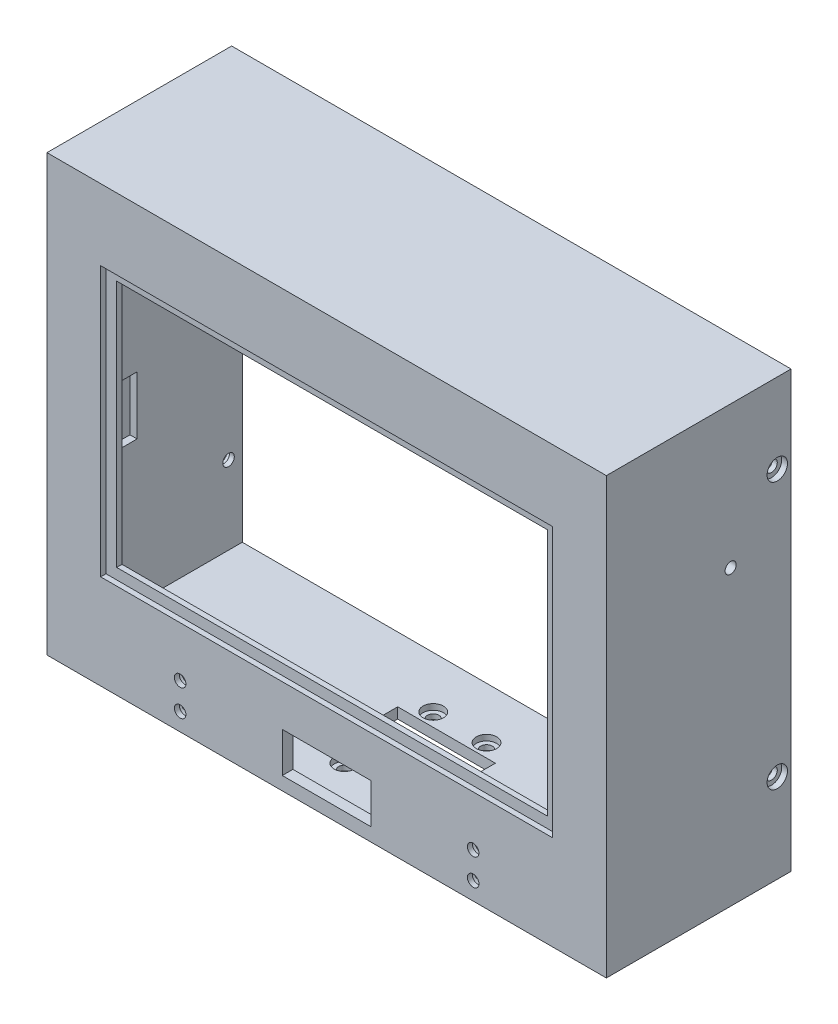
from build123d import *

# Parameters (mm, degrees)
BOSS_EXTRUDE1_START  = 38.4
SKETCH1_W            = 126
SKETCH1_H            = 98
BOSS_EXTRUDE1_DEPTH  = 41.6
BOSS_EXTRUDE2_START  = 36
SKETCH2_W            = 121.2
SKETCH2_H            = 93.2
BOSS_EXTRUDE2_DEPTH  = 41.6
BOSS_EXTRUDE3_START  = 76.6
SKETCH3_W            = 97
SKETCH3_H            = 55.86
BOSS_EXTRUDE3_DEPTH  = 4.4
BOSS_EXTRUDE4_START  = 78.8
SKETCH4_W            = 101.8
SKETCH4_H            = 60.7
BOSS_EXTRUDE4_DEPTH  = 2.2
BOSS_EXTRUDE5_START  = 73.1
SKETCH5_R            = 2.8
BOSS_EXTRUDE5_DEPTH  = 4.5
BOSS_EXTRUDE6_START  = 72.1
SKETCH6_R            = 1
BOSS_EXTRUDE6_DEPTH  = 7.1
BOSS_EXTRUDE7_START  = 73.1
SKETCH7_R            = 2.8
BOSS_EXTRUDE7_DEPTH  = 4.5
BOSS_EXTRUDE8_START  = 72.1
SKETCH8_R            = 1
BOSS_EXTRUDE8_DEPTH  = 7.1
BOSS_EXTRUDE9_START  = 73.1
SKETCH9_R            = 2.8
BOSS_EXTRUDE9_DEPTH  = 4.5
BOSS_EXTRUDE10_START = 72.1
SKETCH10_R           = 1
BOSS_EXTRUDE10_DEPTH = 7.1
BOSS_EXTRUDE11_START = 73.1
SKETCH11_R           = 2.8
BOSS_EXTRUDE11_DEPTH = 4.5
BOSS_EXTRUDE12_START = 72.1
SKETCH12_R           = 1
BOSS_EXTRUDE12_DEPTH = 7.1
BOSS_EXTRUDE13_START = 65.9
SKETCH13_W           = 3.9
SKETCH13_H           = 14
BOSS_EXTRUDE13_DEPTH = 8
BOSS_EXTRUDE14_START = 62.1
SKETCH14_W           = 2.1
SKETCH14_H           = 13.1
BOSS_EXTRUDE14_DEPTH = 12
BOSS_EXTRUDE15_START = -60.6
SKETCH15_R           = 8.3
BOSS_EXTRUDE15_DEPTH = 1.2
BOSS_EXTRUDE16_START = -60.6
SKETCH16_R           = 7.3
BOSS_EXTRUDE16_DEPTH = 1.3
BOSS_EXTRUDE17_START = -64
SKETCH17_R           = 1.25
BOSS_EXTRUDE17_DEPTH = 4.4
BOSS_EXTRUDE18_START = -64
SKETCH18_R           = 1.3
BOSS_EXTRUDE18_DEPTH = 4.4
BOSS_EXTRUDE19_START = -64
SKETCH19_R           = 2.3
BOSS_EXTRUDE19_DEPTH = 2.3
BOSS_EXTRUDE20_START = -64
SKETCH20_R           = 1.3
BOSS_EXTRUDE20_DEPTH = 4.4
BOSS_EXTRUDE21_START = -64
SKETCH21_R           = 2.3
BOSS_EXTRUDE21_DEPTH = 2.3
BOSS_EXTRUDE22_START = 59.4
SKETCH22_R           = 8.3
BOSS_EXTRUDE22_DEPTH = 1.2
BOSS_EXTRUDE23_START = 59.3
SKETCH23_R           = 7.3
BOSS_EXTRUDE23_DEPTH = 1.3
BOSS_EXTRUDE24_START = 59.6
SKETCH24_R           = 1.25
BOSS_EXTRUDE24_DEPTH = 4.4
BOSS_EXTRUDE25_START = 59.6
SKETCH25_R           = 1.3
BOSS_EXTRUDE25_DEPTH = 4.4
BOSS_EXTRUDE26_START = 61.7
SKETCH26_R           = 2.3
BOSS_EXTRUDE26_DEPTH = 2.3
BOSS_EXTRUDE27_START = 59.6
SKETCH27_R           = 1.3
BOSS_EXTRUDE27_DEPTH = 4.4
BOSS_EXTRUDE28_START = 61.7
SKETCH28_R           = 2.3
BOSS_EXTRUDE28_DEPTH = 2.3
BOSS_EXTRUDE29_START = 53
SKETCH29_W           = 22
SKETCH29_H           = 4.4
BOSS_EXTRUDE29_DEPTH = 14
BOSS_EXTRUDE30_START = 59
SKETCH30_R           = 1.3
BOSS_EXTRUDE30_DEPTH = 4.4
BOSS_EXTRUDE31_START = 61.1
SKETCH31_R           = 2.3
BOSS_EXTRUDE31_DEPTH = 1.8
BOSS_EXTRUDE32_START = 59
SKETCH32_R           = 1.3
BOSS_EXTRUDE32_DEPTH = 4.4
BOSS_EXTRUDE33_START = 61.1
SKETCH33_R           = 2.3
BOSS_EXTRUDE33_DEPTH = 1.8
BOSS_EXTRUDE34_START = 59
SKETCH34_R           = 1.3
BOSS_EXTRUDE34_DEPTH = 4.4
BOSS_EXTRUDE35_START = 61.1
SKETCH35_R           = 2.3
BOSS_EXTRUDE35_DEPTH = 1.8
BOSS_EXTRUDE36_START = 59
SKETCH36_R           = 1.3
BOSS_EXTRUDE36_DEPTH = 4.4
BOSS_EXTRUDE37_START = 61.1
SKETCH37_R           = 2.3
BOSS_EXTRUDE37_DEPTH = 1.8
BOSS_EXTRUDE38_START = 76.6
SKETCH38_W           = 20
SKETCH38_H           = 9
BOSS_EXTRUDE38_DEPTH = 4.4
BOSS_EXTRUDE39_START = 76.6
SKETCH39_R           = 1.3
BOSS_EXTRUDE39_DEPTH = 4.4
BOSS_EXTRUDE40_START = 77.1
SKETCH40_R           = 2.3
BOSS_EXTRUDE40_DEPTH = 1.8
BOSS_EXTRUDE41_START = 76.6
SKETCH41_R           = 1.3
BOSS_EXTRUDE41_DEPTH = 4.4
BOSS_EXTRUDE42_START = 77.1
SKETCH42_R           = 2.3
BOSS_EXTRUDE42_DEPTH = 1.8
BOSS_EXTRUDE43_START = 76.6
SKETCH43_R           = 1.3
BOSS_EXTRUDE43_DEPTH = 4.4
BOSS_EXTRUDE44_START = 77.1
SKETCH44_R           = 2.3
BOSS_EXTRUDE44_DEPTH = 1.8
BOSS_EXTRUDE45_START = 76.6
SKETCH45_R           = 1.3
BOSS_EXTRUDE45_DEPTH = 4.4
BOSS_EXTRUDE46_START = 77.1
SKETCH46_R           = 2.3
BOSS_EXTRUDE46_DEPTH = 1.8
BOSS_EXTRUDE47_START = 152.6
SKETCH47_R           = 2.8
BOSS_EXTRUDE47_DEPTH = 3
BOSS_EXTRUDE48_START = 152.1
SKETCH48_R           = 1
BOSS_EXTRUDE48_DEPTH = 5.1


with BuildPart() as part:
    # Sketch1 → Boss-Extrude1 (new body)
    with BuildSketch(Plane.XY.offset(BOSS_EXTRUDE1_START)):
        with Locations((0, 109)):
            Rectangle(SKETCH1_W, SKETCH1_H)
    extrude(amount=BOSS_EXTRUDE1_DEPTH)


with BuildPart() as body_2:
    # Sketch2 → Boss-Extrude2 (new body)
    with BuildSketch(Plane.XY.offset(BOSS_EXTRUDE2_START)):
        with Locations((0, 109)):
            Rectangle(SKETCH2_W, SKETCH2_H)
    extrude(amount=BOSS_EXTRUDE2_DEPTH)


with BuildPart() as part_1:
    add(part.part)

    # Combine1: cut body 2
    add(body_2.part, mode=Mode.SUBTRACT)


with BuildPart() as body_2_2:
    # Sketch3 → Boss-Extrude3 (new body)
    with BuildSketch(Plane.XY.offset(BOSS_EXTRUDE3_START)):
        with Locations((0, 111.67)):
            Rectangle(SKETCH3_W, SKETCH3_H)
    extrude(amount=BOSS_EXTRUDE3_DEPTH)


with BuildPart() as part_2:
    add(part_1.part)

    # Combine2: cut body 2 2
    add(body_2_2.part, mode=Mode.SUBTRACT)


with BuildPart() as body_2_3:
    # Sketch4 → Boss-Extrude4 (new body)
    with BuildSketch(Plane.XY.offset(BOSS_EXTRUDE4_START)):
        with Locations((0, 111.65)):
            Rectangle(SKETCH4_W, SKETCH4_H)
    extrude(amount=BOSS_EXTRUDE4_DEPTH)


with BuildPart() as part_3:
    add(part_2.part)

    # Combine3: cut body 2 3
    add(body_2_3.part, mode=Mode.SUBTRACT)

    # Sketch5 → Boss-Extrude5 (add)
    with BuildSketch(Plane.XY.offset(BOSS_EXTRUDE5_START)):
        with Locations((-56.3, 78.45)):
            Circle(SKETCH5_R)
    extrude(amount=BOSS_EXTRUDE5_DEPTH)


with BuildPart() as body_2_4:
    # Sketch6 → Boss-Extrude6 (new body)
    with BuildSketch(Plane.XY.offset(BOSS_EXTRUDE6_START)):
        with Locations((-56.3, 78.45)):
            Circle(SKETCH6_R)
    extrude(amount=BOSS_EXTRUDE6_DEPTH)


with BuildPart() as part_4:
    add(part_3.part)

    # Combine4: cut body 2 4
    add(body_2_4.part, mode=Mode.SUBTRACT)

    # Sketch7 → Boss-Extrude7 (add)
    with BuildSketch(Plane.XY.offset(BOSS_EXTRUDE7_START)):
        with Locations((-56.3, 140.55)):
            Circle(SKETCH7_R)
    extrude(amount=BOSS_EXTRUDE7_DEPTH)


with BuildPart() as body_2_5:
    # Sketch8 → Boss-Extrude8 (new body)
    with BuildSketch(Plane.XY.offset(BOSS_EXTRUDE8_START)):
        with Locations((-56.3, 140.55)):
            Circle(SKETCH8_R)
    extrude(amount=BOSS_EXTRUDE8_DEPTH)


with BuildPart() as part_5:
    add(part_4.part)

    # Combine5: cut body 2 5
    add(body_2_5.part, mode=Mode.SUBTRACT)

    # Sketch9 → Boss-Extrude9 (add)
    with BuildSketch(Plane.XY.offset(BOSS_EXTRUDE9_START)):
        with Locations((56.3, 78.45)):
            Circle(SKETCH9_R)
    extrude(amount=BOSS_EXTRUDE9_DEPTH)


with BuildPart() as body_2_6:
    # Sketch10 → Boss-Extrude10 (new body)
    with BuildSketch(Plane.XY.offset(BOSS_EXTRUDE10_START)):
        with Locations((56.3, 78.45)):
            Circle(SKETCH10_R)
    extrude(amount=BOSS_EXTRUDE10_DEPTH)


with BuildPart() as part_6:
    add(part_5.part)

    # Combine6: cut body 2 6
    add(body_2_6.part, mode=Mode.SUBTRACT)

    # Sketch11 → Boss-Extrude11 (add)
    with BuildSketch(Plane.XY.offset(BOSS_EXTRUDE11_START)):
        with Locations((56.3, 140.55)):
            Circle(SKETCH11_R)
    extrude(amount=BOSS_EXTRUDE11_DEPTH)


with BuildPart() as body_2_7:
    # Sketch12 → Boss-Extrude12 (new body)
    with BuildSketch(Plane.XY.offset(BOSS_EXTRUDE12_START)):
        with Locations((56.3, 140.55)):
            Circle(SKETCH12_R)
    extrude(amount=BOSS_EXTRUDE12_DEPTH)


with BuildPart() as part_7:
    add(part_6.part)

    # Combine7: cut body 2 7
    add(body_2_7.part, mode=Mode.SUBTRACT)


with BuildPart() as body_2_8:
    # Sketch13 → Boss-Extrude13 (new body)
    with BuildSketch(Plane.XY.offset(BOSS_EXTRUDE13_START)):
        with Locations((-62.05, 114.5)):
            Rectangle(SKETCH13_W, SKETCH13_H)
    extrude(amount=BOSS_EXTRUDE13_DEPTH)


with BuildPart() as part_8:
    add(part_7.part)

    # Combine8: cut body 2 8
    add(body_2_8.part, mode=Mode.SUBTRACT)


with BuildPart() as body_2_9:
    # Sketch14 → Boss-Extrude14 (new body)
    with BuildSketch(Plane.XY.offset(BOSS_EXTRUDE14_START)):
        with Locations((-61.15, 100.95)):
            Rectangle(SKETCH14_W, SKETCH14_H)
    extrude(amount=BOSS_EXTRUDE14_DEPTH)


with BuildPart() as part_9:
    add(part_8.part)

    # Combine9: cut body 2 9
    add(body_2_9.part, mode=Mode.SUBTRACT)

    # Sketch15 → Boss-Extrude15 (add)
    with BuildSketch(Plane(origin=(0, 0, 0), x_dir=(0, 0, -1), z_dir=(1, 0, 0)).offset(BOSS_EXTRUDE15_START)):
        with Locations((-52, 126)):
            Circle(SKETCH15_R)
    extrude(amount=BOSS_EXTRUDE15_DEPTH)


with BuildPart() as body_2_10:
    # Sketch16 → Boss-Extrude16 (new body)
    with BuildSketch(Plane(origin=(0, 0, 0), x_dir=(0, 0, -1), z_dir=(1, 0, 0)).offset(BOSS_EXTRUDE16_START)):
        with Locations((-52, 126)):
            Circle(SKETCH16_R)
    extrude(amount=BOSS_EXTRUDE16_DEPTH)


with BuildPart() as part_10:
    add(part_9.part)

    # Combine10: cut body 2 10
    add(body_2_10.part, mode=Mode.SUBTRACT)


with BuildPart() as body_2_11:
    # Sketch17 → Boss-Extrude17 (new body)
    with BuildSketch(Plane(origin=(0, 0, 0), x_dir=(0, 0, -1), z_dir=(1, 0, 0)).offset(BOSS_EXTRUDE17_START)):
        with Locations((-52, 126)):
            Circle(SKETCH17_R)
    extrude(amount=BOSS_EXTRUDE17_DEPTH)


with BuildPart() as part_11:
    add(part_10.part)

    # Combine11: cut body 2 11
    add(body_2_11.part, mode=Mode.SUBTRACT)


with BuildPart() as body_2_12:
    # Sketch18 → Boss-Extrude18 (new body)
    with BuildSketch(Plane(origin=(0, 0, 0), x_dir=(0, 0, -1), z_dir=(1, 0, 0)).offset(BOSS_EXTRUDE18_START)):
        with Locations((-41.5, 80)):
            Circle(SKETCH18_R)
    extrude(amount=BOSS_EXTRUDE18_DEPTH)


with BuildPart() as part_12:
    add(part_11.part)

    # Combine12: cut body 2 12
    add(body_2_12.part, mode=Mode.SUBTRACT)


with BuildPart() as body_2_13:
    # Sketch19 → Boss-Extrude19 (new body)
    with BuildSketch(Plane(origin=(0, 0, 0), x_dir=(0, 0, -1), z_dir=(1, 0, 0)).offset(BOSS_EXTRUDE19_START)):
        with Locations((-41.5, 80)):
            Circle(SKETCH19_R)
    extrude(amount=BOSS_EXTRUDE19_DEPTH)


with BuildPart() as part_13:
    add(part_12.part)

    # Combine13: cut body 2 13
    add(body_2_13.part, mode=Mode.SUBTRACT)


with BuildPart() as body_2_14:
    # Sketch20 → Boss-Extrude20 (new body)
    with BuildSketch(Plane(origin=(0, 0, 0), x_dir=(0, 0, -1), z_dir=(1, 0, 0)).offset(BOSS_EXTRUDE20_START)):
        with Locations((-41.5, 140)):
            Circle(SKETCH20_R)
    extrude(amount=BOSS_EXTRUDE20_DEPTH)


with BuildPart() as part_14:
    add(part_13.part)

    # Combine14: cut body 2 14
    add(body_2_14.part, mode=Mode.SUBTRACT)


with BuildPart() as body_2_15:
    # Sketch21 → Boss-Extrude21 (new body)
    with BuildSketch(Plane(origin=(0, 0, 0), x_dir=(0, 0, -1), z_dir=(1, 0, 0)).offset(BOSS_EXTRUDE21_START)):
        with Locations((-41.5, 140)):
            Circle(SKETCH21_R)
    extrude(amount=BOSS_EXTRUDE21_DEPTH)


with BuildPart() as part_15:
    add(part_14.part)

    # Combine15: cut body 2 15
    add(body_2_15.part, mode=Mode.SUBTRACT)

    # Sketch22 → Boss-Extrude22 (add)
    with BuildSketch(Plane(origin=(0, 0, 0), x_dir=(0, 0, -1), z_dir=(1, 0, 0)).offset(BOSS_EXTRUDE22_START)):
        with Locations((-52, 126)):
            Circle(SKETCH22_R)
    extrude(amount=BOSS_EXTRUDE22_DEPTH)


with BuildPart() as body_2_16:
    # Sketch23 → Boss-Extrude23 (new body)
    with BuildSketch(Plane(origin=(0, 0, 0), x_dir=(0, 0, -1), z_dir=(1, 0, 0)).offset(BOSS_EXTRUDE23_START)):
        with Locations((-52, 126)):
            Circle(SKETCH23_R)
    extrude(amount=BOSS_EXTRUDE23_DEPTH)


with BuildPart() as part_16:
    add(part_15.part)

    # Combine16: cut body 2 16
    add(body_2_16.part, mode=Mode.SUBTRACT)


with BuildPart() as body_2_17:
    # Sketch24 → Boss-Extrude24 (new body)
    with BuildSketch(Plane(origin=(0, 0, 0), x_dir=(0, 0, -1), z_dir=(1, 0, 0)).offset(BOSS_EXTRUDE24_START)):
        with Locations((-52, 126)):
            Circle(SKETCH24_R)
    extrude(amount=BOSS_EXTRUDE24_DEPTH)


with BuildPart() as part_17:
    add(part_16.part)

    # Combine17: cut body 2 17
    add(body_2_17.part, mode=Mode.SUBTRACT)


with BuildPart() as body_2_18:
    # Sketch25 → Boss-Extrude25 (new body)
    with BuildSketch(Plane(origin=(0, 0, 0), x_dir=(0, 0, -1), z_dir=(1, 0, 0)).offset(BOSS_EXTRUDE25_START)):
        with Locations((-41.5, 80)):
            Circle(SKETCH25_R)
    extrude(amount=BOSS_EXTRUDE25_DEPTH)


with BuildPart() as part_18:
    add(part_17.part)

    # Combine18: cut body 2 18
    add(body_2_18.part, mode=Mode.SUBTRACT)


with BuildPart() as body_2_19:
    # Sketch26 → Boss-Extrude26 (new body)
    with BuildSketch(Plane(origin=(0, 0, 0), x_dir=(0, 0, -1), z_dir=(1, 0, 0)).offset(BOSS_EXTRUDE26_START)):
        with Locations((-41.5, 80)):
            Circle(SKETCH26_R)
    extrude(amount=BOSS_EXTRUDE26_DEPTH)


with BuildPart() as part_19:
    add(part_18.part)

    # Combine19: cut body 2 19
    add(body_2_19.part, mode=Mode.SUBTRACT)


with BuildPart() as body_2_20:
    # Sketch27 → Boss-Extrude27 (new body)
    with BuildSketch(Plane(origin=(0, 0, 0), x_dir=(0, 0, -1), z_dir=(1, 0, 0)).offset(BOSS_EXTRUDE27_START)):
        with Locations((-41.5, 140)):
            Circle(SKETCH27_R)
    extrude(amount=BOSS_EXTRUDE27_DEPTH)


with BuildPart() as part_20:
    add(part_19.part)

    # Combine20: cut body 2 20
    add(body_2_20.part, mode=Mode.SUBTRACT)


with BuildPart() as body_2_21:
    # Sketch28 → Boss-Extrude28 (new body)
    with BuildSketch(Plane(origin=(0, 0, 0), x_dir=(0, 0, -1), z_dir=(1, 0, 0)).offset(BOSS_EXTRUDE28_START)):
        with Locations((-41.5, 140)):
            Circle(SKETCH28_R)
    extrude(amount=BOSS_EXTRUDE28_DEPTH)


with BuildPart() as part_21:
    add(part_20.part)

    # Combine21: cut body 2 21
    add(body_2_21.part, mode=Mode.SUBTRACT)


with BuildPart() as body_2_22:
    # Sketch29 → Boss-Extrude29 (new body)
    with BuildSketch(Plane.XY.offset(BOSS_EXTRUDE29_START)):
        with Locations((0, 61.2)):
            Rectangle(SKETCH29_W, SKETCH29_H)
    extrude(amount=BOSS_EXTRUDE29_DEPTH)


with BuildPart() as part_22:
    add(part_21.part)

    # Combine22: cut body 2 22
    add(body_2_22.part, mode=Mode.SUBTRACT)


with BuildPart() as body_2_23:
    # Sketch30 → Boss-Extrude30 (new body)
    with BuildSketch(Plane(origin=(0, 0, 0), x_dir=(1, 0, 0), z_dir=(0, 1, 0)).offset(BOSS_EXTRUDE30_START)):
        with Locations((-6, -50)):
            Circle(SKETCH30_R)
    extrude(amount=BOSS_EXTRUDE30_DEPTH)


with BuildPart() as part_23:
    add(part_22.part)

    # Combine23: cut body 2 23
    add(body_2_23.part, mode=Mode.SUBTRACT)


with BuildPart() as body_2_24:
    # Sketch31 → Boss-Extrude31 (new body)
    with BuildSketch(Plane(origin=(0, 0, 0), x_dir=(1, 0, 0), z_dir=(0, 1, 0)).offset(BOSS_EXTRUDE31_START)):
        with Locations((-6, -50)):
            Circle(SKETCH31_R)
    extrude(amount=BOSS_EXTRUDE31_DEPTH)


with BuildPart() as part_24:
    add(part_23.part)

    # Combine24: cut body 2 24
    add(body_2_24.part, mode=Mode.SUBTRACT)


with BuildPart() as body_2_25:
    # Sketch32 → Boss-Extrude32 (new body)
    with BuildSketch(Plane(origin=(0, 0, 0), x_dir=(1, 0, 0), z_dir=(0, 1, 0)).offset(BOSS_EXTRUDE32_START)):
        with Locations((-6, -70)):
            Circle(SKETCH32_R)
    extrude(amount=BOSS_EXTRUDE32_DEPTH)


with BuildPart() as part_25:
    add(part_24.part)

    # Combine25: cut body 2 25
    add(body_2_25.part, mode=Mode.SUBTRACT)


with BuildPart() as body_2_26:
    # Sketch33 → Boss-Extrude33 (new body)
    with BuildSketch(Plane(origin=(0, 0, 0), x_dir=(1, 0, 0), z_dir=(0, 1, 0)).offset(BOSS_EXTRUDE33_START)):
        with Locations((-6, -70)):
            Circle(SKETCH33_R)
    extrude(amount=BOSS_EXTRUDE33_DEPTH)


with BuildPart() as part_26:
    add(part_25.part)

    # Combine26: cut body 2 26
    add(body_2_26.part, mode=Mode.SUBTRACT)


with BuildPart() as body_2_27:
    # Sketch34 → Boss-Extrude34 (new body)
    with BuildSketch(Plane(origin=(0, 0, 0), x_dir=(1, 0, 0), z_dir=(0, 1, 0)).offset(BOSS_EXTRUDE34_START)):
        with Locations((6, -50)):
            Circle(SKETCH34_R)
    extrude(amount=BOSS_EXTRUDE34_DEPTH)


with BuildPart() as part_27:
    add(part_26.part)

    # Combine27: cut body 2 27
    add(body_2_27.part, mode=Mode.SUBTRACT)


with BuildPart() as body_2_28:
    # Sketch35 → Boss-Extrude35 (new body)
    with BuildSketch(Plane(origin=(0, 0, 0), x_dir=(1, 0, 0), z_dir=(0, 1, 0)).offset(BOSS_EXTRUDE35_START)):
        with Locations((6, -50)):
            Circle(SKETCH35_R)
    extrude(amount=BOSS_EXTRUDE35_DEPTH)


with BuildPart() as part_28:
    add(part_27.part)

    # Combine28: cut body 2 28
    add(body_2_28.part, mode=Mode.SUBTRACT)


with BuildPart() as body_2_29:
    # Sketch36 → Boss-Extrude36 (new body)
    with BuildSketch(Plane(origin=(0, 0, 0), x_dir=(1, 0, 0), z_dir=(0, 1, 0)).offset(BOSS_EXTRUDE36_START)):
        with Locations((6, -70)):
            Circle(SKETCH36_R)
    extrude(amount=BOSS_EXTRUDE36_DEPTH)


with BuildPart() as part_29:
    add(part_28.part)

    # Combine29: cut body 2 29
    add(body_2_29.part, mode=Mode.SUBTRACT)


with BuildPart() as body_2_30:
    # Sketch37 → Boss-Extrude37 (new body)
    with BuildSketch(Plane(origin=(0, 0, 0), x_dir=(1, 0, 0), z_dir=(0, 1, 0)).offset(BOSS_EXTRUDE37_START)):
        with Locations((6, -70)):
            Circle(SKETCH37_R)
    extrude(amount=BOSS_EXTRUDE37_DEPTH)


with BuildPart() as part_30:
    add(part_29.part)

    # Combine30: cut body 2 30
    add(body_2_30.part, mode=Mode.SUBTRACT)


with BuildPart() as body_2_31:
    # Sketch38 → Boss-Extrude38 (new body)
    with BuildSketch(Plane.XY.offset(BOSS_EXTRUDE38_START)):
        with Locations((0, 67.5)):
            Rectangle(SKETCH38_W, SKETCH38_H)
    extrude(amount=BOSS_EXTRUDE38_DEPTH)


with BuildPart() as part_31:
    add(part_30.part)

    # Combine31: cut body 2 31
    add(body_2_31.part, mode=Mode.SUBTRACT)


with BuildPart() as body_2_32:
    # Sketch39 → Boss-Extrude39 (new body)
    with BuildSketch(Plane.XY.offset(BOSS_EXTRUDE39_START)):
        with Locations((-33, 64)):
            Circle(SKETCH39_R)
    extrude(amount=BOSS_EXTRUDE39_DEPTH)


with BuildPart() as part_32:
    add(part_31.part)

    # Combine32: cut body 2 32
    add(body_2_32.part, mode=Mode.SUBTRACT)


with BuildPart() as body_2_33:
    # Sketch40 → Boss-Extrude40 (new body)
    with BuildSketch(Plane.XY.offset(BOSS_EXTRUDE40_START)):
        with Locations((-33, 64)):
            Circle(SKETCH40_R)
    extrude(amount=BOSS_EXTRUDE40_DEPTH)


with BuildPart() as part_33:
    add(part_32.part)

    # Combine33: cut body 2 33
    add(body_2_33.part, mode=Mode.SUBTRACT)


with BuildPart() as body_2_34:
    # Sketch41 → Boss-Extrude41 (new body)
    with BuildSketch(Plane.XY.offset(BOSS_EXTRUDE41_START)):
        with Locations((-33, 70)):
            Circle(SKETCH41_R)
    extrude(amount=BOSS_EXTRUDE41_DEPTH)


with BuildPart() as part_34:
    add(part_33.part)

    # Combine34: cut body 2 34
    add(body_2_34.part, mode=Mode.SUBTRACT)


with BuildPart() as body_2_35:
    # Sketch42 → Boss-Extrude42 (new body)
    with BuildSketch(Plane.XY.offset(BOSS_EXTRUDE42_START)):
        with Locations((-33, 70)):
            Circle(SKETCH42_R)
    extrude(amount=BOSS_EXTRUDE42_DEPTH)


with BuildPart() as part_35:
    add(part_34.part)

    # Combine35: cut body 2 35
    add(body_2_35.part, mode=Mode.SUBTRACT)


with BuildPart() as body_2_36:
    # Sketch43 → Boss-Extrude43 (new body)
    with BuildSketch(Plane.XY.offset(BOSS_EXTRUDE43_START)):
        with Locations((33, 64)):
            Circle(SKETCH43_R)
    extrude(amount=BOSS_EXTRUDE43_DEPTH)


with BuildPart() as part_36:
    add(part_35.part)

    # Combine36: cut body 2 36
    add(body_2_36.part, mode=Mode.SUBTRACT)


with BuildPart() as body_2_37:
    # Sketch44 → Boss-Extrude44 (new body)
    with BuildSketch(Plane.XY.offset(BOSS_EXTRUDE44_START)):
        with Locations((33, 64)):
            Circle(SKETCH44_R)
    extrude(amount=BOSS_EXTRUDE44_DEPTH)


with BuildPart() as part_37:
    add(part_36.part)

    # Combine37: cut body 2 37
    add(body_2_37.part, mode=Mode.SUBTRACT)


with BuildPart() as body_2_38:
    # Sketch45 → Boss-Extrude45 (new body)
    with BuildSketch(Plane.XY.offset(BOSS_EXTRUDE45_START)):
        with Locations((33, 70)):
            Circle(SKETCH45_R)
    extrude(amount=BOSS_EXTRUDE45_DEPTH)


with BuildPart() as part_38:
    add(part_37.part)

    # Combine38: cut body 2 38
    add(body_2_38.part, mode=Mode.SUBTRACT)


with BuildPart() as body_2_39:
    # Sketch46 → Boss-Extrude46 (new body)
    with BuildSketch(Plane.XY.offset(BOSS_EXTRUDE46_START)):
        with Locations((33, 70)):
            Circle(SKETCH46_R)
    extrude(amount=BOSS_EXTRUDE46_DEPTH)


with BuildPart() as part_39:
    add(part_38.part)

    # Combine39: cut body 2 39
    add(body_2_39.part, mode=Mode.SUBTRACT)

    # Sketch47 → Boss-Extrude47 (add)
    with BuildSketch(Plane(origin=(0, 0, 0), x_dir=(1, 0, 0), z_dir=(0, 1, 0)).offset(BOSS_EXTRUDE47_START)):
        with Locations((0, -46)):
            Circle(SKETCH47_R)
    extrude(amount=BOSS_EXTRUDE47_DEPTH)


with BuildPart() as body_2_40:
    # Sketch48 → Boss-Extrude48 (new body)
    with BuildSketch(Plane(origin=(0, 0, 0), x_dir=(1, 0, 0), z_dir=(0, 1, 0)).offset(BOSS_EXTRUDE48_START)):
        with Locations((0, -46)):
            Circle(SKETCH48_R)
    extrude(amount=BOSS_EXTRUDE48_DEPTH)


with BuildPart() as part_40:
    add(part_39.part)

    # Combine40: cut body 2 40
    add(body_2_40.part, mode=Mode.SUBTRACT)


solid = part_40.part
